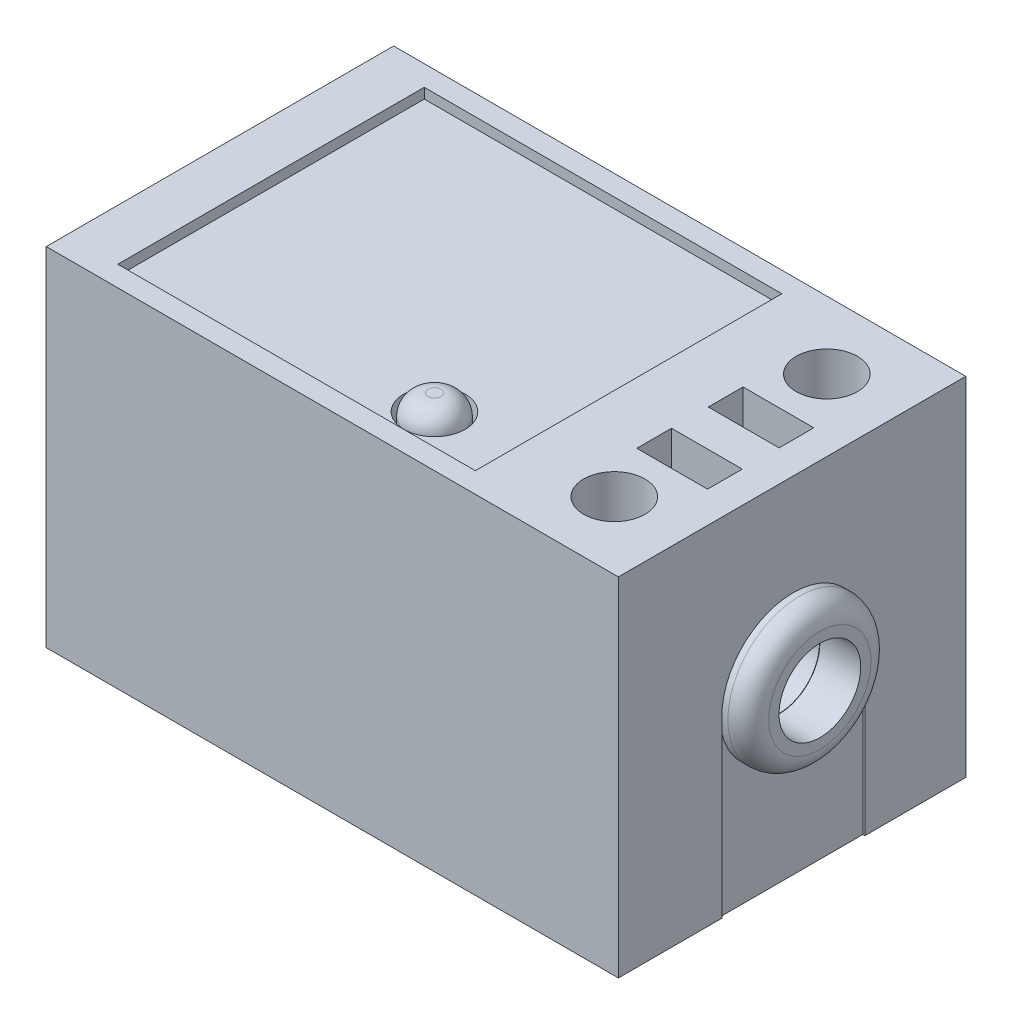
from build123d import *

# Parameters (mm, degrees)
SKETCH_1_W              = 28
SKETCH_1_H              = 17
EXTRUDE_1_DEPTH         = 17
SKETCH_2_R              = 1.5
CUT_EXTRUDE_2_DEPTH     = 17
SKETCH_3_R              = 1.5
CUT_EXTRUDE_3_DEPTH     = 5
SKETCH_4_W              = 17.5
SKETCH_4_H              = 15
CUT_EXTRUDE_4_DEPTH     = 0.5
CUT_EXTRUDE_START       = -0.5
CUT_EXTRUDE_1_OUTLINE_R = 6.815064579
CUT_EXTRUDE_1_DEPTH     = 0.5
CUT_EXTRUDE_5_DEPTH     = 0.7
EXTRUDE_START           = 2
SKETCH_7_R              = 3.5
SKETCH_7_R_2            = 2
EXTRUDE_2_DEPTH         = 2
FILLET_1_R              = 1
EXTRUDE_START_2         = 0.6
EXTRUDE_17_DEPTH        = 0.6
EXTRUDE_18_DEPTH        = 0.8
EXTRUDE_18_DEPTH_BACK   = 1
SKETCH_9_R              = 1.311922651
FILLET_2_R              = 1
SKETCH_10_W             = 3.463451164
SKETCH_10_H             = 1.7
CUT_EXTRUDE_6_DEPTH     = 5
CUT_EXTRUDE_START_2     = 3.82238806
CUT_EXTRUDE_7_OUTLINE_R = 1.979264392
CUT_EXTRUDE_7_DEPTH     = 8


# Read off the part's stored shape, not the designer's step: Вырез-Вытянуть-Тонкостенный1, Вырез-Вытянуть7
with BuildPart() as part:
    # Эскиз1 → Бобышка-Вытянуть1 (new body)
    with BuildSketch(Plane.XY):
        with Locations((-1.47761194, 0.824626866)):
            Rectangle(SKETCH_1_W, SKETCH_1_H)
    extrude(amount=EXTRUDE_1_DEPTH)

    # Эскиз2 → Вырез-Вытянуть2 (cut)
    with BuildSketch(Plane(origin=(0, 9.324626866, 0), x_dir=(1, 0, 0), z_dir=(0, 1, 0))):
        with Locations(Location((9.02238806, -3.3, 0), (0, 0, 180))):
            Circle(SKETCH_2_R)
        with Locations(Location((9.02238806, -13.7, 0), (0, 0, 180))):
            Circle(SKETCH_2_R)
    extrude(amount=-CUT_EXTRUDE_2_DEPTH, mode=Mode.SUBTRACT)

    # Эскиз3 → Вырез-Вытянуть3 (cut)
    with BuildSketch(Plane(origin=(0, 9.324626866, 0), x_dir=(1, 0, 0), z_dir=(0, 1, 0))):
        with Locations(Location((0.52238806, -14, 0), (0, 0, 180))):
            Circle(SKETCH_3_R)
    extrude(amount=-CUT_EXTRUDE_3_DEPTH, mode=Mode.SUBTRACT)

    # Эскиз4 → Вырез-Вытянуть4 (cut)
    with BuildSketch(Plane(origin=(0, 9.324626866, 0), x_dir=(1, 0, 0), z_dir=(0, 1, 0))):
        with Locations((-4.22761194, -8.5)):
            Rectangle(SKETCH_4_W, SKETCH_4_H)
    extrude(amount=-CUT_EXTRUDE_4_DEPTH, mode=Mode.SUBTRACT)

    # Вырез-Вытянуть-Тонкостенный1 outline → Вырез-Вытянуть-Тонкостенный1 (cut)
    with BuildSketch(Plane.ZY.offset(15.47761194).offset(CUT_EXTRUDE_START)):
        with Locations((8.5, 0.824626866)):
            Circle(CUT_EXTRUDE_1_OUTLINE_R)
        with BuildLine():
            Line((2.189885845, 0.574626866), (5.174644222, 0.574626866))
            ThreePointArc((5.174644222, 0.574626866), (6.141982713, -1.533390421), (8.25, -2.500728912))
            Line((8.25, -2.500728912), (8.25, -5.485487289))
            ThreePointArc((8.25, -5.485487289), (4.034575012, -3.640798122), (2.189885845, 0.574626866))
        make_face(mode=Mode.SUBTRACT)
        with BuildLine():
            ThreePointArc((8.25, -1.999067704), (6.495536104, -1.17983703), (5.67630543, 0.574626866))
            Line((5.67630543, 0.574626866), (8.25, 0.574626866))
            Line((8.25, 0.574626866), (8.25, -1.999067704))
        make_face(mode=Mode.SUBTRACT)
        with BuildLine():
            Line((8.75, -5.485487289), (8.75, -2.500728912))
            ThreePointArc((8.75, -2.500728912), (10.858017287, -1.533390421), (11.825355778, 0.574626866))
            Line((11.825355778, 0.574626866), (14.810114155, 0.574626866))
            ThreePointArc((14.810114155, 0.574626866), (12.965424988, -3.640798122), (8.75, -5.485487289))
        make_face(mode=Mode.SUBTRACT)
        with BuildLine():
            ThreePointArc((11.32369457, 0.574626866), (10.504463896, -1.17983703), (8.75, -1.999067704))
            Line((8.75, -1.999067704), (8.75, 0.574626866))
            Line((8.75, 0.574626866), (11.32369457, 0.574626866))
        make_face(mode=Mode.SUBTRACT)
        with BuildLine():
            ThreePointArc((5.67630543, 1.074626866), (6.495536104, 2.829090762), (8.25, 3.648321435))
            Line((8.25, 3.648321435), (8.25, 1.074626866))
            Line((8.25, 1.074626866), (5.67630543, 1.074626866))
        make_face(mode=Mode.SUBTRACT)
        with BuildLine():
            Line((8.25, 7.13474102), (8.25, 4.149982644))
            ThreePointArc((8.25, 4.149982644), (6.141982714, 3.182644152), (5.174644222, 1.074626866))
            Line((5.174644222, 1.074626866), (2.189885845, 1.074626866))
            ThreePointArc((2.189885845, 1.074626866), (4.034575012, 5.290051853), (8.25, 7.13474102))
        make_face(mode=Mode.SUBTRACT)
        with BuildLine():
            ThreePointArc((8.75, 3.648321435), (10.504463896, 2.829090762), (11.32369457, 1.074626866))
            Line((11.32369457, 1.074626866), (8.75, 1.074626866))
            Line((8.75, 1.074626866), (8.75, 3.648321435))
        make_face(mode=Mode.SUBTRACT)
        with BuildLine():
            Line((14.810114155, 1.074626866), (11.825355778, 1.074626866))
            ThreePointArc((11.825355778, 1.074626866), (10.858017286, 3.182644152), (8.75, 4.149982644))
            Line((8.75, 4.149982644), (8.75, 7.13474102))
            ThreePointArc((8.75, 7.13474102), (12.965424988, 5.290051853), (14.810114155, 1.074626866))
        make_face(mode=Mode.SUBTRACT)
    extrude(amount=CUT_EXTRUDE_1_DEPTH, mode=Mode.SUBTRACT)

    # Эскиз6 → Вырез-Вытянуть5 (cut)
    with BuildSketch(Plane(origin=(12.52238806, 0, 0), x_dir=(0, 0, -1), z_dir=(1, 0, 0))):
        with BuildLine():
            Line((-11.938898547, -7.675373134), (-11.938898547, 0.878920234))
            ThreePointArc((-11.938898547, 0.878920234), (-8.438898547, 4.378920234), (-4.938898547, 0.878920234))
            Line((-4.938898547, 0.878920234), (-4.938898547, -7.675373134))
            Line((-4.938898547, -7.675373134), (-11.938898547, -7.675373134))
        make_face()
    extrude(amount=-CUT_EXTRUDE_5_DEPTH, mode=Mode.SUBTRACT)

    # Эскиз7 → Бобышка-Вытянуть2 (add)
    with BuildSketch(Plane(origin=(11.82238806, 0, 0), x_dir=(0, 0, -1), z_dir=(1, 0, 0)).offset(EXTRUDE_START)):
        with Locations((-8.438898547, 0.878920234)):
            Circle(SKETCH_7_R)
        with Locations((-8.438898547, 0.878920234)):
            Circle(SKETCH_7_R_2, mode=Mode.SUBTRACT)
    extrude(amount=-EXTRUDE_2_DEPTH)

    # Скругление1
    fillet_1_edges = [part.edges().sort_by_distance(p)[0] for p in [
        (13.82238806, 0.878920234, 11.938898547),
    ]]
    fillet(fillet_1_edges, radius=FILLET_1_R)

    # Эскиз8 → Бобышка-Вытянуть17 (add)
    with BuildSketch(Plane(origin=(11.82238806, 0, 0), x_dir=(0, 0, -1), z_dir=(1, 0, 0)).offset(EXTRUDE_START_2)):
        with BuildLine():
            Line((-11.938898547, -7.675373134), (-4.938898547, -7.675373134))
            Line((-4.938898547, -7.675373134), (-4.938898547, 0.878920234))
            ThreePointArc((-4.938898547, 0.878920234), (-8.438898547, -2.621079766), (-11.938898547, 0.878920234))
            Line((-11.938898547, 0.878920234), (-11.938898547, -7.675373134))
        make_face()
    extrude(amount=-EXTRUDE_17_DEPTH)

    # Эскиз10 → Вырез-Вытянуть6 (cut)
    with BuildSketch(Plane(origin=(0, 9.324626866, 0), x_dir=(1, 0, 0), z_dir=(0, 1, 0))):
        with Locations((9.254113642, -10.25)):
            Rectangle(SKETCH_10_W, SKETCH_10_H)
        with Locations((9.254113642, -6.75)):
            Rectangle(SKETCH_10_W, SKETCH_10_H)
    extrude(amount=-CUT_EXTRUDE_6_DEPTH, mode=Mode.SUBTRACT)

    # Вырез-Вытянуть7 outline → Вырез-Вытянуть7 (cut)
    with BuildSketch(Plane.YZ.offset(CUT_EXTRUDE_START_2)):
        with Locations((0.878920234, 8.438898547)):
            Circle(CUT_EXTRUDE_7_OUTLINE_R)
    extrude(amount=CUT_EXTRUDE_7_DEPTH, mode=Mode.SUBTRACT)


with BuildPart() as body_2:
    # Эскиз9 → Бобышка-Вытянуть18 (new, two sides: drawn at the far end of the back side and taken through both)
    with BuildSketch(Plane(origin=(0, 8.824626866, 0), x_dir=(1, 0, 0), z_dir=(0, 1, 0)).offset(-EXTRUDE_18_DEPTH_BACK)):
        with Locations(Location((0.52238806, -14, 0), (0, 0, 180))):
            Circle(SKETCH_9_R)
    extrude(amount=EXTRUDE_18_DEPTH + EXTRUDE_18_DEPTH_BACK)

    # Скругление2
    fillet_2_edges = [body_2.edges().sort_by_distance(p)[0] for p in [
        (1.834310711, 9.624626866, 14),
    ]]
    fillet(fillet_2_edges, radius=FILLET_2_R)


solid = Compound([part.part, body_2.part])
